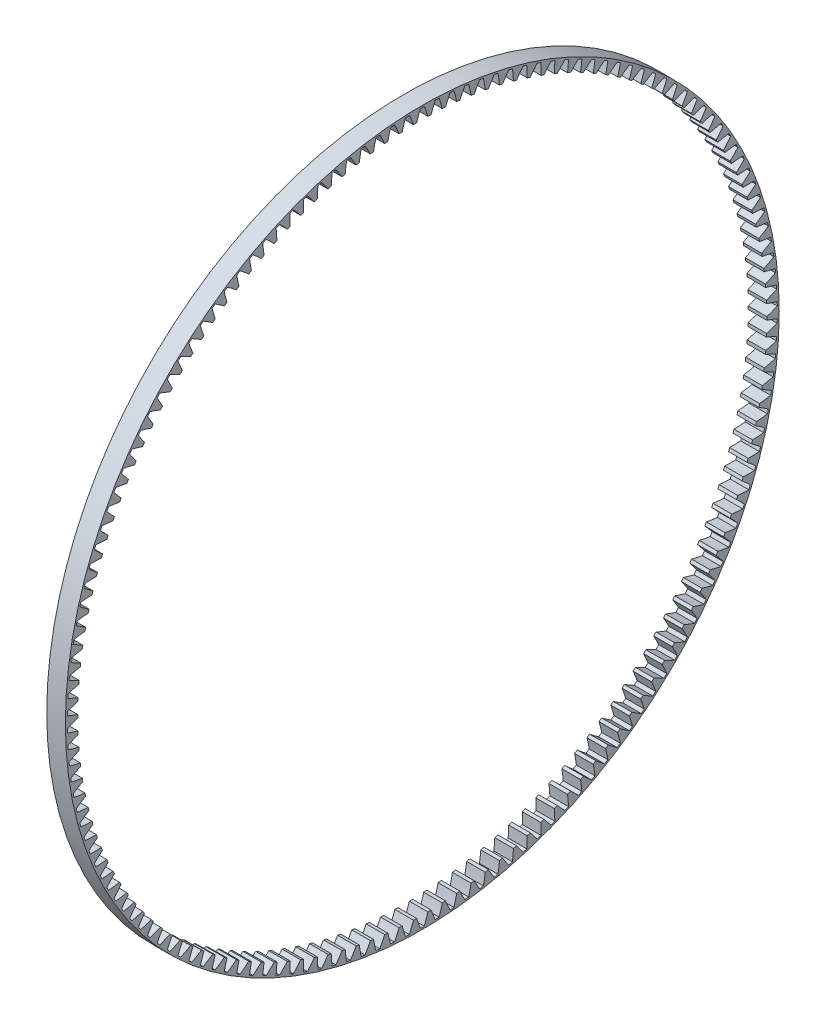
from build123d import *

# Parameters (mm, degrees)
BASPROSKE_W     = 12
BASPROSKE_H     = 8
TOOTHCUT_DEPTH  = 326.490399244
TEETHCUTS_COUNT = 150
TEETHCUTS_ANGLE = 357.6


with BuildPart() as part:
    # BasProSke → Base-Revolve (revolve)
    with BuildSketch(Plane(origin=(0, 0, 0), x_dir=(1, 0, 0), z_dir=(0, 1, 0))):
        with Locations((6, 226)):
            Rectangle(BASPROSKE_W, BASPROSKE_H)
    revolve(axis=Axis((-10, 0, 0), (1, 0, 0)))

    # TooCutSke → ToothCut (cut, through all)
    with BuildSketch(Plane(origin=(0, 0, 0), x_dir=(0, 0, -1), z_dir=(1, 0, 0))):
        with BuildLine():
            ThreePointArc((3.628530001, 221.944940954), (2.491006809, 225.365377166), (1.244486926, 228.747614749))
            ThreePointArc((1.244486926, 228.747614749), (0, 228.751), (-1.244486926, 228.747614749))
            ThreePointArc((-1.244486926, 228.747614749), (-2.491006809, 225.365377166), (-3.628530001, 221.944940954))
            ThreePointArc((-3.628530001, 221.944940954), (0, 221.9746), (3.628530001, 221.944940954))
        make_face()
    toothcut = extrude(amount=TOOTHCUT_DEPTH, mode=Mode.SUBTRACT)

    # TeethCuts: ToothCut ×150 about axis
    teethcuts_axis = Axis((-10, 0, 0), (1, 0, 0))
    for i in range(1, TEETHCUTS_COUNT):
        add(toothcut.rotate(teethcuts_axis, i * TEETHCUTS_ANGLE / (TEETHCUTS_COUNT - 1)), mode=Mode.SUBTRACT)


solid = part.part
